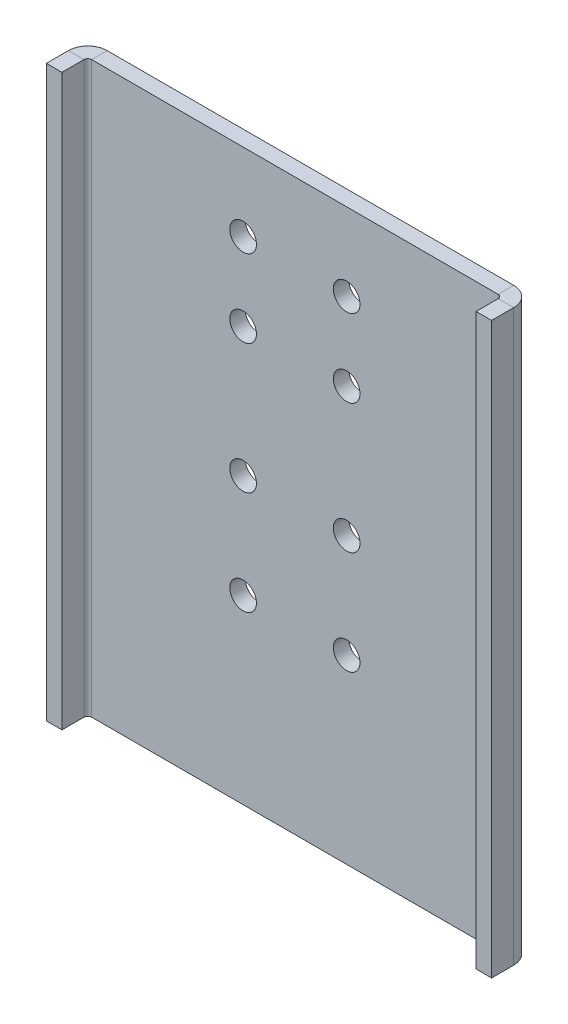
from build123d import *

# Parameters (mm, degrees)
SKETCH1_W                      = 86
SKETCH1_H                      = 110
BASE_FLANGE1_DEPTH             = 3
SKETCH6_R                      = 2.58
CUT_EXTRUDE1_DEPTH             = 3
EDGE_FLANGE1_STRIP_W           = 13.4732
EDGE_FLANGE1_STRIP_H           = 3
EDGE_FLANGE1_STRIP_CUT_DEPTH   = 110
EDGE_FLANGE1_STRIP_2_W         = 13.4732
EDGE_FLANGE1_STRIP_2_H         = 3
EDGE_FLANGE1_STRIP_CUT_2_DEPTH = 110
EDGE_FLANGE1_DEPTH             = 110
EDGE_FLANGE1_BEND_DEPTH        = 110


# Sheet-metal steps are written as plain solids
with BuildPart() as part:
    # Sketch1 → Base-Flange1 (new body)
    with BuildSketch(Plane.XY):
        Rectangle(SKETCH1_W, SKETCH1_H)
    extrude(amount=-BASE_FLANGE1_DEPTH)

    # Sketch6 → Cut-Extrude1 (cut)
    with BuildSketch(Plane.XY):
        with Locations((-10, 40)):
            Circle(SKETCH6_R)
        with Locations((10, 40)):
            Circle(SKETCH6_R)
        with Locations((-10, 25)):
            Circle(SKETCH6_R)
        with Locations((10, 25)):
            Circle(SKETCH6_R)
        with Locations((10, 0)):
            Circle(SKETCH6_R)
        with Locations((-10, 0)):
            Circle(SKETCH6_R)
        with Locations((-10, -20)):
            Circle(SKETCH6_R)
        with Locations((10, -20)):
            Circle(SKETCH6_R)
    extrude(amount=-CUT_EXTRUDE1_DEPTH, mode=Mode.SUBTRACT)

    # Edge-Flange1 strip (across the edge) → Edge-Flange1 strip cut (cut)
    with BuildSketch(Plane(origin=(-43, 55, 0), x_dir=(1, 0, 0), z_dir=(0, -1, 0))):
        with Locations((-3, -1.5)):
            Rectangle(EDGE_FLANGE1_STRIP_W, EDGE_FLANGE1_STRIP_H)
    extrude(amount=EDGE_FLANGE1_STRIP_CUT_DEPTH, mode=Mode.SUBTRACT)

    # Edge-Flange1 strip 2 (across the edge) → Edge-Flange1 strip cut 2 (cut)
    with BuildSketch(Plane(origin=(43, -55, 0), x_dir=(-1, 0, 0), z_dir=(0, 1, 0))):
        with Locations((-3, -1.5)):
            Rectangle(EDGE_FLANGE1_STRIP_2_W, EDGE_FLANGE1_STRIP_2_H)
    extrude(amount=EDGE_FLANGE1_STRIP_CUT_2_DEPTH, mode=Mode.SUBTRACT)

    # Edge-Flange1 section (across the edge) → Edge-Flange1 (add)
    with BuildSketch(Plane(origin=(-43, 55, 0), x_dir=(1, 0, 0), z_dir=(0, -1, 0))):
        with BuildLine():
            Line((0, 0.7366), (0, 5))
            Line((0, 5), (3, 5))
            Line((3, 5), (3, 0.7366))
            ThreePointArc((3, 0.7366), (3.215745145, 0.215745145), (3.7366, 0))
            Line((3.7366, 0), (3.7366, -3))
            ThreePointArc((3.7366, -3), (1.094424801, -1.905575199), (0, 0.7366))
        make_face()
    extrude(amount=EDGE_FLANGE1_DEPTH)

    # Edge-Flange1 section 2 (across the edge) → Edge-Flange1 bend (add)
    with BuildSketch(Plane(origin=(43, -55, 0), x_dir=(-1, 0, 0), z_dir=(0, 1, 0))):
        with BuildLine():
            Line((0, 0.7366), (0, 5))
            Line((0, 5), (3, 5))
            Line((3, 5), (3, 0.7366))
            ThreePointArc((3, 0.7366), (3.215745145, 0.215745145), (3.7366, 0))
            Line((3.7366, 0), (3.7366, -3))
            ThreePointArc((3.7366, -3), (1.094424801, -1.905575199), (0, 0.7366))
        make_face()
    extrude(amount=EDGE_FLANGE1_BEND_DEPTH)


solid = part.part
